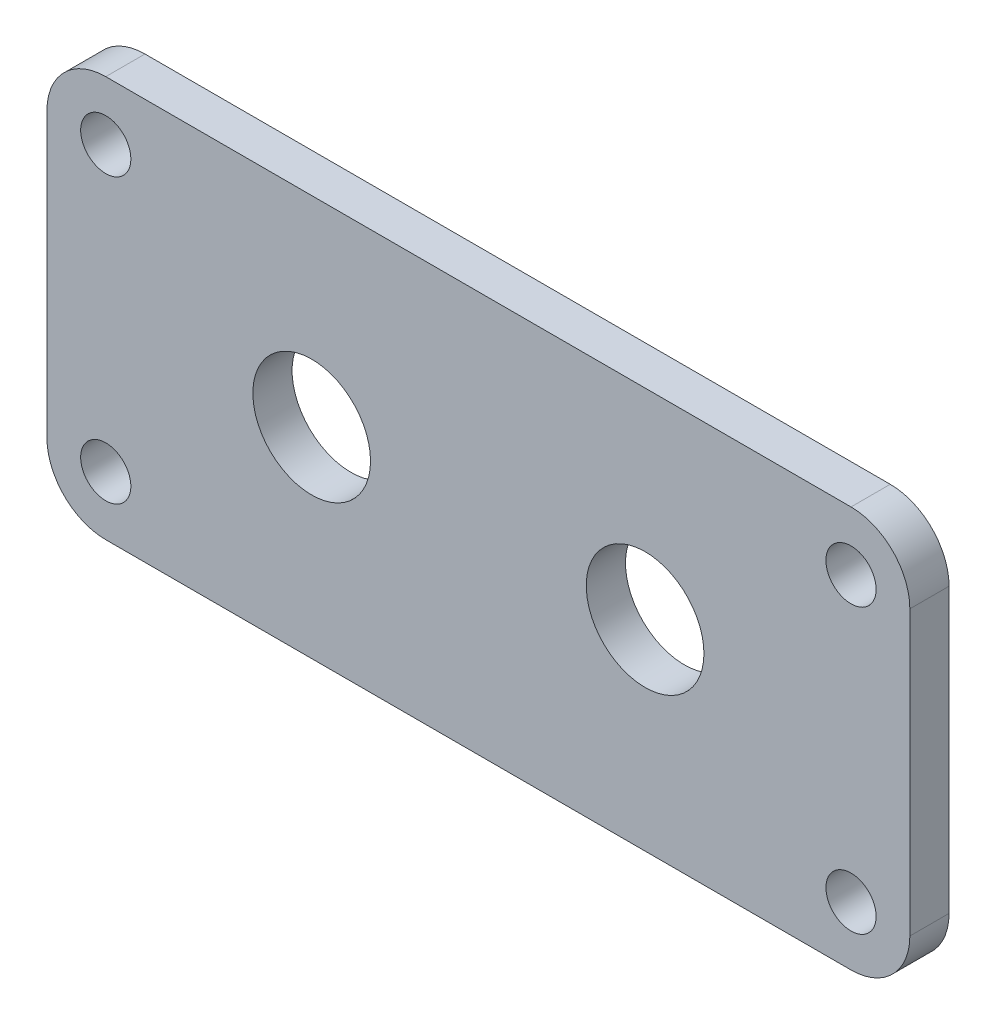
from build123d import *

# Parameters (mm, degrees)
SKETCH1_R           = 4.7625
SKETCH1_R_2         = 2.032
BOSS_EXTRUDE1_DEPTH = 3.175


with BuildPart() as part:
    # Sketch1 → Boss-Extrude1 (new body)
    with BuildSketch(Plane.XY):
        with BuildLine():
            Line((43.65625, -16.2306), (-16.66875, -16.2306))
            ThreePointArc((-16.66875, -16.2306), (-20.036346045, -14.835696045), (-21.43125, -11.4681))
            Line((-21.43125, -11.4681), (-21.43125, 11.4681))
            ThreePointArc((-21.43125, 11.4681), (-20.036346045, 14.835696045), (-16.66875, 16.2306))
            Line((-16.66875, 16.2306), (43.65625, 16.2306))
            ThreePointArc((43.65625, 16.2306), (47.023846045, 14.835696045), (48.41875, 11.4681))
            Line((48.41875, 11.4681), (48.41875, -11.4681))
            ThreePointArc((48.41875, -11.4681), (47.023846045, -14.835696045), (43.65625, -16.2306))
        make_face()
        Circle(SKETCH1_R, mode=Mode.SUBTRACT)
        with Locations((26.9875, 0)):
            Circle(SKETCH1_R, mode=Mode.SUBTRACT)
        with Locations((-16.66875, 11.4681)):
            Circle(SKETCH1_R_2, mode=Mode.SUBTRACT)
        with Locations((43.65625, 11.4681)):
            Circle(SKETCH1_R_2, mode=Mode.SUBTRACT)
        with Locations((-16.66875, -11.4681)):
            Circle(SKETCH1_R_2, mode=Mode.SUBTRACT)
        with Locations((43.65625, -11.4681)):
            Circle(SKETCH1_R_2, mode=Mode.SUBTRACT)
    extrude(amount=BOSS_EXTRUDE1_DEPTH)


solid = part.part
